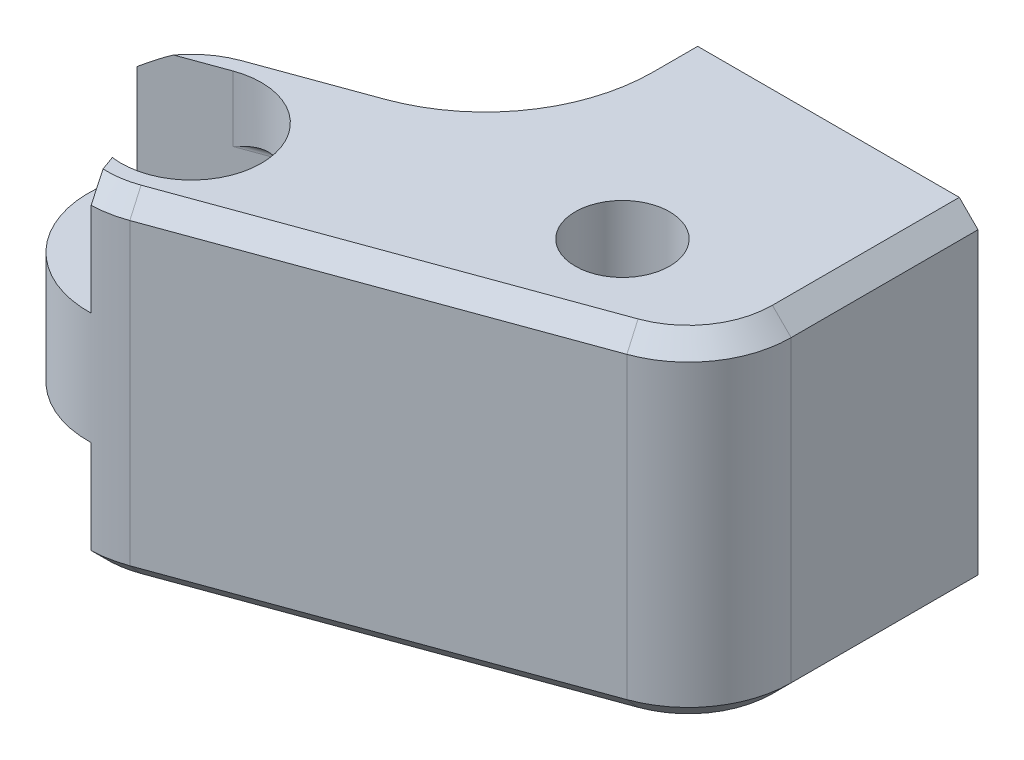
from build123d import *

# Parameters (mm, degrees)
EXTRUDE_1_DEPTH     = 14.999999999999998
CUT_EXTRUDE_1_DEPTH = 32.759958749611776
CUT_EXTRUDE_2_DEPTH = 5.999999999999998
CUT_EXTRUDE_START   = -2.9999999999999996
CUT_EXTRUDE_3_DEPTH = 2.9999999999999996
CUT_EXTRUDE_START_2 = -3.0000000000000004
CUT_EXTRUDE_4_DEPTH = 3.0000000000000004
CUT_EXTRUDE_5_DEPTH = 10.50007039461797
CUT_EXTRUDE_6_DEPTH = 11.327672160759418
EXTRUDE_2_DEPTH     = 7.968709711177614
EXTRUDE_3_DEPTH     = 3.000000000000002
HOLE_WIZARD_1_D     = 4.2
HOLE_WIZARD_1_DEPTH = 7
HOLE_WIZARD_2_D     = 2.03
HOLE_WIZARD_2_DEPTH = 4
HOLE_WIZARD_3_D     = 2.03
HOLE_WIZARD_3_DEPTH = 4
HOLE_WIZARD_4_D     = 5.05
HOLE_WIZARD_5_D     = 5.02
HOLE_WIZARD_5_DEPTH = 12
FILLET_1_R          = 5.500000000000002
FILLET_2_R          = 8
CHAMFER_1_SIZE      = 0.9999999999999993
FILLET_3_R          = 0.5


with BuildPart() as part:
    # 草图1 → 凸台-拉伸1 (new body)
    with BuildSketch(Plane(origin=(0, 18, 0), x_dir=(1, 0, 0), z_dir=(0, 1, 0))):
        with BuildLine():
            Line((-17.618889211708797, -12.26572898251346), (21.661848401793918, 2.0312902888225244))
            Line((21.661848401793918, 2.0312902888225244), (-10.5, 2.0312902888223876))
            Line((-10.5, 2.0312902888223876), (-21.381110788291235, -1.9291101538684705))
            ThreePointArc((-21.381110788291235, -1.9291101538684705), (-24.668309414322497, -8.978530356482176), (-17.618889211708797, -12.26572898251346))
        make_face()
    extrude(amount=-EXTRUDE_1_DEPTH)

    # 草图2 → 切除-拉伸1 (cut, through all)
    with BuildSketch(Plane(origin=(0, 18, 0), x_dir=(-1, 0, 0), z_dir=(0, 1, 0))):
        Polygon((-21.66184840179392, -2.0312902888223894), (-5.5000000000000036, -2.0312902888223876), (-5.500000000000005, 3.8511414601534057), align=None)
    extrude(amount=-CUT_EXTRUDE_1_DEPTH, mode=Mode.SUBTRACT)

    # 草图3 → 切除-拉伸2 (cut)
    with BuildSketch(Plane(origin=(0, 18, 0), x_dir=(-1, 0, 0), z_dir=(0, 1, 0))):
        with BuildLine():
            Line((20.78257553747125, 3.5735722402438013), (24.563305918164147, 4.949645562601932))
            ThreePointArc((24.563305918164147, 4.949645562601932), (24.047293898775088, 10.191303567012326), (19.3611131717343, 12.59566569299606))
            Line((19.3611131717343, 12.59566569299606), (20.01010960022055, 10.812562660423456))
            ThreePointArc((20.01010960022055, 10.812562660423456), (15.771169677152303, 6.6995195513380725), (20.78257553747125, 3.5735722402438013))
        make_face()
    extrude(amount=-CUT_EXTRUDE_2_DEPTH, mode=Mode.SUBTRACT)

    # 草图4 → 切除-拉伸3 (cut)
    with BuildSketch(Plane.XZ.offset(-12).offset(CUT_EXTRUDE_START)):
        with BuildLine():
            Line((-20.78257553747125, 3.573572240243805), (-18.036485631419698, 2.5740772538221752))
            Line((-18.036485631419698, 2.5740772538221752), (-17.557657430763733, 3.889646922922488))
            ThreePointArc((-17.557657430763733, 3.889646922922488), (-19.134214632183554, 3.365302064053206), (-20.78257553747125, 3.573572240243805))
        make_face()
    extrude(amount=CUT_EXTRUDE_3_DEPTH, mode=Mode.SUBTRACT)

    # 草图5 → 切除-拉伸4 (cut)
    with BuildSketch(Plane.XZ.offset(-3.000000000000001).offset(CUT_EXTRUDE_START_2)):
        with BuildLine():
            Line((-17.258794358827192, 2.29102077914986), (-16.779966158171227, 3.606590448250214))
            Line((-16.779966158171227, 3.606590448250214), (-17.557657430763737, 3.8896469229224904))
            ThreePointArc((-17.557657430763737, 3.8896469229224904), (-15.965242102135065, 8.349612286378331), (-20.01010960022055, 10.81256266042346))
            Line((-20.01010960022055, 10.81256266042346), (-19.3611131717343, 12.59566569299606))
            ThreePointArc((-19.3611131717343, 12.59566569299606), (-24.04729389877508, 10.191303567012337), (-24.56330591816415, 4.94964556260195))
            Line((-24.56330591816415, 4.94964556260195), (-17.258794358827192, 2.29102077914986))
        make_face()
    extrude(amount=CUT_EXTRUDE_4_DEPTH, mode=Mode.SUBTRACT)

    # 草图6 → 切除-拉伸5 (cut)
    with BuildSketch(Plane(origin=(-15.97621882135595, 0, 5.8148681070970145), x_dir=(0.3420201433256677, 0, 0.9396926207859088), z_dir=(-0.9396926207859089, 0, 0.3420201433256677))):
        Polygon((-2.3499999999999055, 3), (-2.349999999999906, 6), (-3.7499999999999933, 6), (-3.749999999999994, 3), align=None)
    extrude(amount=-CUT_EXTRUDE_5_DEPTH, mode=Mode.SUBTRACT)

    # 草图7 → 切除-拉伸6 (cut)
    with BuildSketch(Plane(origin=(-16.753910093948367, 0, 6.097924581769449), x_dir=(0.3420201433256676, 0, 0.9396926207859088), z_dir=(-0.9396926207859088, 0, 0.3420201433256676))):
        Polygon((-3.749999999999993, 12), (-2.3499999999999055, 12), (-2.3499999999999055, 15), (-3.7499999999999933, 15), align=None)
    extrude(amount=-CUT_EXTRUDE_6_DEPTH, mode=Mode.SUBTRACT)

    # 草图8 → 凸台-拉伸2 (add)
    with BuildSketch(Plane(origin=(-8.63e-15, 0, -2.0312902888224325), x_dir=(-1, 0, 5e-17), z_dir=(-5e-17, 0, -1))):
        Polygon((-5.5, 3), (-5.500000000000001, 18), (10.5, 18), (10.5, 3), align=None)
    extrude(amount=EXTRUDE_2_DEPTH)

    # 草图9 → 凸台-拉伸3 (add)
    with BuildSketch(Plane.XZ.offset(-3.000000000000001)):
        with BuildLine():
            Line((-17.618889211708797, 12.26572898251346), (5.499999999999998, 3.8511414601533294))
            Line((5.499999999999998, 3.8511414601533294), (5.5, -10))
            Line((5.5, -10), (-10.5, -10.000000000000002))
            Line((-10.5, -10.000000000000002), (-10.500000000000014, -2.0312902888224262))
            Line((-10.500000000000014, -2.0312902888224262), (-21.381110788291203, 1.9291101538684652))
            ThreePointArc((-21.381110788291203, 1.9291101538684652), (-23.286441520356178, 3.1083268627098155), (-24.563305918164144, 4.94964556260193))
            Line((-24.563305918164144, 4.94964556260193), (-20.78257553747125, 3.573572240243805))
            ThreePointArc((-20.78257553747125, 3.573572240243805), (-15.771169677152304, 6.699519551338072), (-20.01010960022055, 10.81256266042346))
            Line((-20.01010960022055, 10.81256266042346), (-19.361113171734285, 12.595665692996059))
            ThreePointArc((-19.361113171734285, 12.595665692996059), (-18.476617299855562, 12.50137070130135), (-17.618889211708797, 12.26572898251346))
        make_face()
    extrude(amount=EXTRUDE_3_DEPTH)

    # 孔1
    with Locations(Plane(origin=(-5.4e-16, 0, -10.000000000000046), x_dir=(-1, 0, 5e-17), z_dir=(-5e-17, 0, -1))):
        with Locations((4.5, 9)):
            Hole(HOLE_WIZARD_1_D / 2, depth=HOLE_WIZARD_1_DEPTH)

    # 孔2
    with Locations(Plane(origin=(-5.4e-16, 0, -10.000000000000046), x_dir=(-1, 0, 5e-17), z_dir=(-5e-17, 0, -1))):
        with Locations((-0.5, 13)):
            Hole(HOLE_WIZARD_2_D / 2, depth=HOLE_WIZARD_2_DEPTH)

    # 孔3
    with Locations(Plane(origin=(-5.4e-16, 0, -10.000000000000046), x_dir=(-1, 0, 5e-17), z_dir=(-5e-17, 0, -1))):
        with Locations((-0.5, 5)):
            Hole(HOLE_WIZARD_3_D / 2, depth=HOLE_WIZARD_3_DEPTH)

    # 孔4 (through all)
    with Locations(Plane(origin=(0, 18, 0), x_dir=(1, 0, 0), z_dir=(0, 1, 0))):
        with Locations((-2.585532826, -0.941056988)):
            Hole(HOLE_WIZARD_4_D / 2)

    # 孔5
    with Locations(Plane(origin=(0, 12, 0), x_dir=(1, 0, 0), z_dir=(0, 1, 0))):
        with Locations((-19.5, -7.097419568)):
            Hole(HOLE_WIZARD_5_D / 2, depth=HOLE_WIZARD_5_DEPTH)

    # 圆角1
    fillet_1_edges = [part.edges().sort_by_distance(p)[0] for p in [
        (5.500000000000002, 8.999999999999998, 3.8511414601533676),
    ]]
    fillet(fillet_1_edges, radius=FILLET_1_R)

    # 圆角2
    fillet_2_edges = [part.edges().sort_by_distance(p)[0] for p in [
        (-10.50000000000001, 9, -2.031290288822418),
    ]]
    fillet(fillet_2_edges, radius=FILLET_2_R)

    # 倒角1
    chamfer_1_edges = [part.edges().sort_by_distance(p)[0] for p in [
        (-10.500000000000002, -1.33e-15, -8.816475297250042),
        (-23.286441520356178, -1.33e-15, 3.108326862709817),
        (-11.946783645688082, -7.42e-15, -3.0443391036917093),
        (-18.572474820842935, -1.33e-15, 0.9068502628278257),
        (-18.47661729985556, -1.33e-15, 12.50137070130135),
        (5.499999999999999, -1.33e-15, -5.000000000000032),
        (-7.868889211708797, -1.33e-15, 8.717019198417944),
        (4.505336243589466, -1.65e-14, 3.154670399930683),
        (-23.286441520356195, 18, 3.1083268627098226),
        (-18.57247482084295, 18, 0.9068502628278368),
        (-10.500000000000009, 18, -8.816475297250054),
        (-11.946783645688074, 17.999999999999993, -3.044339103691696),
        (-18.476617299855565, 18, 12.501370701301362),
        (5.4999999999999964, 18, -5.000000000000016),
        (-7.868889211708806, 18, 8.717019198417947),
        (4.505336243589472, 17.999999999999986, 3.15467039993076),
    ]]
    chamfer(chamfer_1_edges, length=CHAMFER_1_SIZE)

    # 圆角3
    fillet_3_edges = [part.edges().sort_by_distance(p)[0] for p in [
        (-14.087265614371635, 15, 1.1366787190484962),
        (-12.23539246068994, 3.0000000000000004, 1.9525008949379348),
        (-14.087265614371681, 3.0000000000000004, 1.1366787190484136),
        (-12.23539246068994, 6.000000000000001, 1.9525008949379346),
        (-12.235392460689857, 15, 1.952500894938097),
        (-15.977630804718132, 6.000000000000001, 1.8247153802274876),
        (-12.235392460689857, 12, 1.952500894938097),
    ]]
    fillet(fillet_3_edges, radius=FILLET_3_R)


solid = part.part
